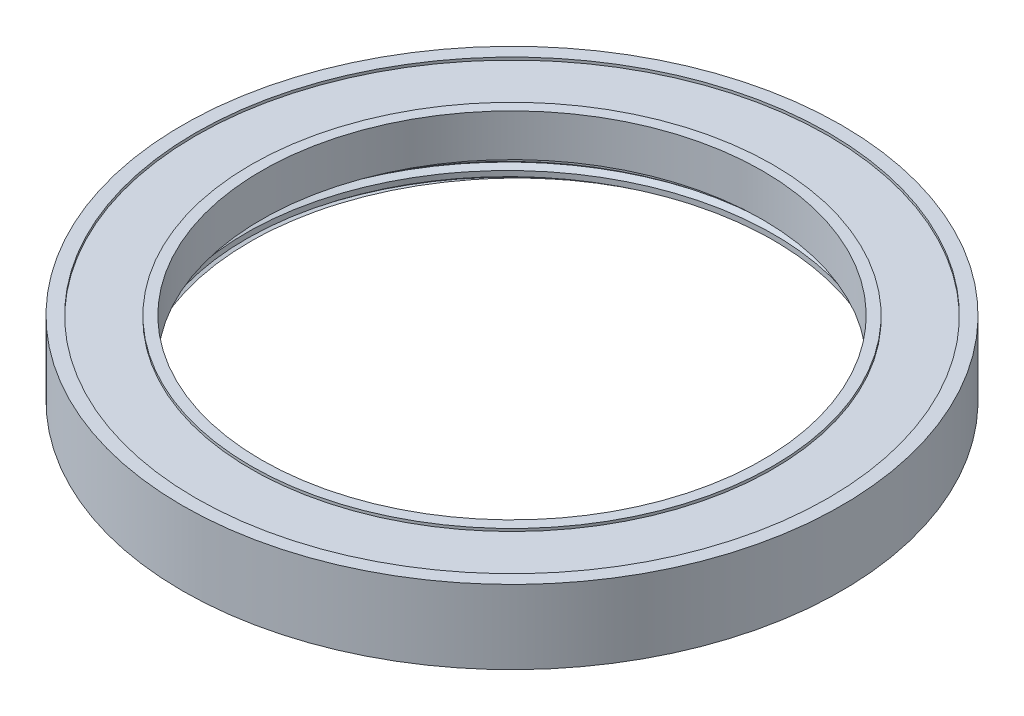
from build123d import *

# Parameters (mm, degrees)
THREAD1_PITCH           = 2.5
THREAD2_PITCH           = 2.5
SKETCH3_W               = 15
SKETCH3_H               = 10
CUT_EXTRUDE1_DEPTH      = 96.495209461
CUT_EXTRUDE2_DEPTH      = 96.495209461
CUT_EXTRUDE2_DEPTH_BACK = 96.495209461
SKETCH4_W               = 125
SKETCH4_H               = 20.019774924


with BuildPart() as part:
    # Sketch2 → Revolve1 (revolve)
    with BuildSketch(Plane(origin=(0, 0, 0), x_dir=(0, 0, -1), z_dir=(1, 0, 0))):
        Polygon((49.5, 36.15), (47.5, 36.15), (47.5, 12.15), (50, 12.15), (50, 6.65), (60, 6.65), (60, 6.15), (62.5, 6.15), (62.5, 20.15), (60, 20.15), (60, 19.65), (49.5, 19.65), align=None)
    revolve(axis=Axis((0, 0, 0), (0, 1, 0)))

    # Thread1: arcs per turn and ends read off the stored shape
    # Thread1: the profile of Thread Profile1 profile screwed along a right-hand helix through 2.4 turns, 10 arcs to a turn; built about Z, then put on its axis
    thread1_z = Axis((0, 0, 0), (0, 0, 1))
    thread1_corners = [(-40.450607014, -29.389086279, -6.000173205), (-41.326636301, -30.025558812, -5.375000003), (-41.326636301, -30.025558812, -5.125000003), (-40.450607014, -29.389086279, -4.4998268)]
    with BuildLine(mode=Mode.PRIVATE) as thread1_profile:
        Line(thread1_corners[0], thread1_corners[1])
        Line(thread1_corners[1], thread1_corners[2])
        Line(thread1_corners[2], thread1_corners[3])
        Line(thread1_corners[3], thread1_corners[0])
    thread1_cap = Face(thread1_profile.wire())
    thread1_turn_angles = [0, 18, 36, 54, 72, 90, 108, 126, 144, 162, 180, 198, 216, 234, 252, 270, 288, 306, 324, 342, 360]
    thread1_turn_weights = [1, 0.9510565162951535, 1, 0.9510565162951535, 1, 0.9510565162951535, 1, 0.9510565162951535, 1, 0.9510565162951535, 1, 0.9510565162951535, 1, 0.9510565162951535, 1, 0.9510565162951535, 1, 0.9510565162951535, 1, 0.9510565162951535, 1]
    thread1_turn_rails = [Edge.make_bspline([Vector(p[0], p[1], 0).rotate(thread1_z, thread1_turn_angles[k]) / thread1_turn_weights[k] + Vector(0, 0, p[2] + THREAD1_PITCH * thread1_turn_angles[k] / 360) for k in range(21)], [0, 0, 0, 1, 1, 2, 2, 3, 3, 4, 4, 5, 5, 6, 6, 7, 7, 8, 8, 9, 9, 10, 10, 10], 2, thread1_turn_weights) for p in thread1_corners]
    thread1_turn_sides = [Face.make_surface_from_curves(thread1_turn_rails[p[0]], thread1_turn_rails[p[1]]) for p in [(0, 1), (1, 2), (2, 3), (3, 0)]]
    thread1_last_angles = [720, 738, 756, 774, 792, 810, 828, 846, 864]
    thread1_last_weights = [1, 0.9510565162951535, 1, 0.9510565162951535, 1, 0.9510565162951535, 1, 0.9510565162951535, 1]
    thread1_last_rails = [Edge.make_bspline([Vector(p[0], p[1], 0).rotate(thread1_z, thread1_last_angles[k]) / thread1_last_weights[k] + Vector(0, 0, p[2] + THREAD1_PITCH * thread1_last_angles[k] / 360) for k in range(9)], [0, 0, 0, 1, 1, 2, 2, 3, 3, 4, 4, 4], 2, thread1_last_weights) for p in thread1_corners]
    thread1_last_sides = [Face.make_surface_from_curves(thread1_last_rails[p[0]], thread1_last_rails[p[1]]) for p in [(0, 1), (1, 2), (2, 3), (3, 0)]]
    thread1 = Plane(origin=(0, 6.65, 0), x_dir=(1, 0, 0), z_dir=(0, -1, 0)) * Solid(Shell([*[p.moved(Location((0, 0, THREAD1_PITCH * i))) for i in range(2) for p in thread1_turn_sides], *thread1_last_sides, thread1_cap, thread1_cap.rotate(thread1_z, 864).moved(Location((0, 0, THREAD1_PITCH * 864 / 360)))]))
    add(thread1, mode=Mode.SUBTRACT)

    # Thread2: arcs per turn and ends read off the stored shape
    # Thread2: the profile of Thread Profile2 profile screwed along a right-hand helix through 1.6 turns, 10 arcs to a turn; built about Z, then put on its axis
    thread2_z = Axis((0, 0, 0), (0, 0, 1))
    thread2_corners = [(49.4997, 0, -0.000173205), (50.58253175, 0, 0.624999997), (50.58253175, 0, 0.874999997), (49.4997, 0, 1.5001732)]
    with BuildLine(mode=Mode.PRIVATE) as thread2_profile:
        Line(thread2_corners[0], thread2_corners[1])
        Line(thread2_corners[1], thread2_corners[2])
        Line(thread2_corners[2], thread2_corners[3])
        Line(thread2_corners[3], thread2_corners[0])
    thread2_cap = Face(thread2_profile.wire())
    thread2_turn_angles = [0, 18, 36, 54, 72, 90, 108, 126, 144, 162, 180, 198, 216, 234, 252, 270, 288, 306, 324, 342, 360]
    thread2_turn_weights = [1, 0.9510565162951535, 1, 0.9510565162951535, 1, 0.9510565162951535, 1, 0.9510565162951535, 1, 0.9510565162951535, 1, 0.9510565162951535, 1, 0.9510565162951535, 1, 0.9510565162951535, 1, 0.9510565162951535, 1, 0.9510565162951535, 1]
    thread2_turn_rails = [Edge.make_bspline([Vector(p[0], p[1], 0).rotate(thread2_z, thread2_turn_angles[k]) / thread2_turn_weights[k] + Vector(0, 0, p[2] + THREAD2_PITCH * thread2_turn_angles[k] / 360) for k in range(21)], [0, 0, 0, 1, 1, 2, 2, 3, 3, 4, 4, 5, 5, 6, 6, 7, 7, 8, 8, 9, 9, 10, 10, 10], 2, thread2_turn_weights) for p in thread2_corners]
    thread2_turn_sides = [Face.make_surface_from_curves(thread2_turn_rails[p[0]], thread2_turn_rails[p[1]]) for p in [(0, 1), (1, 2), (2, 3), (3, 0)]]
    thread2_last_angles = [360, 378, 396, 414, 432, 450, 468, 486, 504, 522, 540, 558, 576]
    thread2_last_weights = [1, 0.9510565162951535, 1, 0.9510565162951535, 1, 0.9510565162951535, 1, 0.9510565162951535, 1, 0.9510565162951535, 1, 0.9510565162951535, 1]
    thread2_last_rails = [Edge.make_bspline([Vector(p[0], p[1], 0).rotate(thread2_z, thread2_last_angles[k]) / thread2_last_weights[k] + Vector(0, 0, p[2] + THREAD2_PITCH * thread2_last_angles[k] / 360) for k in range(13)], [0, 0, 0, 1, 1, 2, 2, 3, 3, 4, 4, 5, 5, 6, 6, 6], 2, thread2_last_weights) for p in thread2_corners]
    thread2_last_sides = [Face.make_surface_from_curves(thread2_last_rails[p[0]], thread2_last_rails[p[1]]) for p in [(0, 1), (1, 2), (2, 3), (3, 0)]]
    thread2 = Plane(origin=(0, 36.15, 0), x_dir=(-1, 0, 0), z_dir=(0, -1, 0)) * Solid(Shell([*thread2_turn_sides, *thread2_last_sides, thread2_cap, thread2_cap.rotate(thread2_z, 576).moved(Location((0, 0, THREAD2_PITCH * 576 / 360)))]))
    add(thread2)

    # Sketch3 → Cut-Extrude1 (cut, through all)
    with BuildSketch(Plane.XY):
        with Locations((0, 26.837500003)):
            Rectangle(SKETCH3_W, SKETCH3_H)
    extrude(amount=-CUT_EXTRUDE1_DEPTH, mode=Mode.SUBTRACT)

    # Sketch4 → Cut-Extrude2 (cut, two sides: drawn at the far end of the back side and taken through both)
    with BuildSketch(Plane(origin=(0, 0, 0), x_dir=(0, 0, -1), z_dir=(1, 0, 0)).offset(-CUT_EXTRUDE2_DEPTH_BACK)):
        with Locations((0, 30.159887462)):
            Rectangle(SKETCH4_W, SKETCH4_H)
    extrude(amount=CUT_EXTRUDE2_DEPTH + CUT_EXTRUDE2_DEPTH_BACK, mode=Mode.SUBTRACT)


solid = part.part
